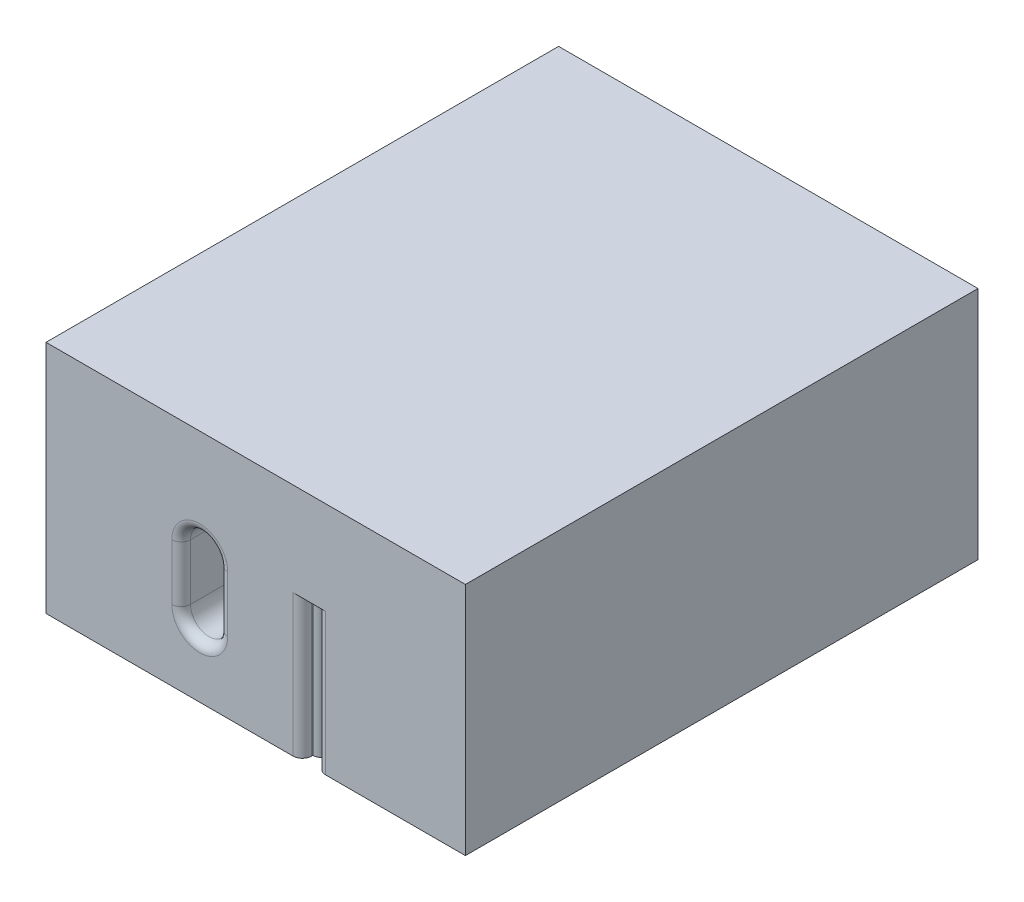
from build123d import *

# Parameters (mm, degrees)
ESQUISSE1_W             = 45
ESQUISSE1_H             = 25.2
BOSS_EXTRU_1_DEPTH      = 55
ENL_V_MAT_EXTRU_1_DEPTH = 15.2
ESQUISSE4_W             = 2
ESQUISSE4_H             = 11.757289378
ESQUISSE4_H_2           = 8.71932614
BOSS_EXTRU_2_DEPTH      = 15.2
BOSS_EXTRU_3_DEPTH      = 15.2
CONG_2_R                = 1
CONG_5_R                = 1
CONG_10_R               = 1


with BuildPart() as part:
    # Esquisse1 → Boss.-Extru.1 (new body)
    with BuildSketch(Plane.XY):
        with Locations((0, 2)):
            Rectangle(ESQUISSE1_W, ESQUISSE1_H)
        with BuildLine():
            Line((-4, 3), (-4, -3))
            ThreePointArc((-4, -3), (-6, -5), (-8, -3))
            Line((-8, -3), (-8, 3))
            ThreePointArc((-8, 3), (-6, 5), (-4, 3))
        make_face(mode=Mode.SUBTRACT)
    extrude(amount=BOSS_EXTRU_1_DEPTH)

    # Esquisse3 → Enlèv. mat.-Extru.1 (cut)
    with BuildSketch(Plane.XZ.offset(10.6)):
        with BuildLine():
            Line((5, 55), (5, 39.485421243))
            ThreePointArc((5, 39.485421243), (4.865561607, 38.024962206), (4.46676485, 36.613588609))
            Line((4.46676485, 36.613588609), (0.53323515, 26.386411391))
            ThreePointArc((0.53323515, 26.386411391), (0.134438393, 24.975037794), (0, 23.514578757))
            Line((0, 23.514578757), (0, 0))
            Line((0, 0), (2, 0))
            Line((2, 0), (2, 17.43865228))
            ThreePointArc((2, 17.43865228), (2.100303516, 18.986949278), (2.399537266, 20.509363004))
            Line((2.399537266, 20.509363004), (6.100462734, 34.490636996))
            ThreePointArc((6.100462734, 34.490636996), (6.399696484, 36.013050722), (6.5, 37.56134772))
            Line((6.5, 37.56134772), (6.5, 55))
            Line((6.5, 55), (5, 55))
        make_face()
        with BuildLine():
            Line((5, 17.43865228), (5, 0))
            Line((5, 0), (6.5, 0))
            Line((6.5, 0), (6.5, 15.514578757))
            ThreePointArc((6.5, 15.514578757), (6.634438393, 16.975037794), (7.03323515, 18.386411391))
            Line((7.03323515, 18.386411391), (10.96676485, 28.613588609))
            ThreePointArc((10.96676485, 28.613588609), (11.365561607, 30.024962206), (11.5, 31.485421243))
            Line((11.5, 31.485421243), (11.5, 55))
            Line((11.5, 55), (9.5, 55))
            Line((9.5, 55), (9.5, 37.56134772))
            ThreePointArc((9.5, 37.56134772), (9.399696484, 36.013050722), (9.100462734, 34.490636996))
            Line((9.100462734, 34.490636996), (5.399537266, 20.509363004))
            ThreePointArc((5.399537266, 20.509363004), (5.100303516, 18.986949278), (5, 17.43865228))
        make_face()
    extrude(amount=-ENL_V_MAT_EXTRU_1_DEPTH, mode=Mode.SUBTRACT)

    # Esquisse4 → Boss.-Extru.2 (add)
    with BuildSketch(Plane.XZ.offset(10.6)):
        with Locations((10.5, 49.121355311)):
            Rectangle(ESQUISSE4_W, ESQUISSE4_H)
        with Locations((1, 4.35966307)):
            Rectangle(ESQUISSE4_W, ESQUISSE4_H_2)
    extrude(amount=-BOSS_EXTRU_2_DEPTH)

    # Esquisse5 → Boss.-Extru.3 (add)
    with BuildSketch(Plane.XZ.offset(10.6)):
        with BuildLine():
            Line((5, 53.85), (5, 53.15))
            ThreePointArc((5, 53.15), (5.40348257, 53.21803486), (5.7, 53.5))
            ThreePointArc((5.7, 53.5), (5.40348257, 53.78196514), (5, 53.85))
        make_face()
        with BuildLine():
            Line((5, 51.85), (5, 51.15))
            ThreePointArc((5, 51.15), (5.40348257, 51.21803486), (5.7, 51.5))
            ThreePointArc((5.7, 51.5), (5.40348257, 51.78196514), (5, 51.85))
        make_face()
        with BuildLine():
            Line((5, 49.85), (5, 49.15))
            ThreePointArc((5, 49.15), (5.40348257, 49.21803486), (5.7, 49.5))
            ThreePointArc((5.7, 49.5), (5.40348257, 49.78196514), (5, 49.85))
        make_face()
        with BuildLine():
            Line((5, 47.85), (5, 47.15))
            ThreePointArc((5, 47.15), (5.40348257, 47.21803486), (5.7, 47.5))
            ThreePointArc((5.7, 47.5), (5.40348257, 47.78196514), (5, 47.85))
        make_face()
        with BuildLine():
            Line((5, 45.85), (5, 45.15))
            ThreePointArc((5, 45.15), (5.40348257, 45.21803486), (5.7, 45.5))
            ThreePointArc((5.7, 45.5), (5.40348257, 45.78196514), (5, 45.85))
        make_face()
        with BuildLine():
            Line((5, 43.85), (5, 43.15))
            ThreePointArc((5, 43.15), (5.40348257, 43.21803486), (5.7, 43.5))
            ThreePointArc((5.7, 43.5), (5.40348257, 43.78196514), (5, 43.85))
        make_face()
        with BuildLine():
            Line((5, 41.85), (5, 41.15))
            ThreePointArc((5, 41.15), (5.40348257, 41.21803486), (5.7, 41.5))
            ThreePointArc((5.7, 41.5), (5.40348257, 41.78196514), (5, 41.85))
        make_face()
        with BuildLine():
            Line((5, 39.85), (5, 39.15))
            ThreePointArc((5, 39.15), (5.40348257, 39.21803486), (5.7, 39.5))
            ThreePointArc((5.7, 39.5), (5.40348257, 39.78196514), (5, 39.85))
        make_face()
        with BuildLine():
            Line((5, 1.15), (5, 1.85))
            ThreePointArc((5, 1.85), (5.40348257, 1.78196514), (5.7, 1.5))
            ThreePointArc((5.7, 1.5), (5.40348257, 1.21803486), (5, 1.15))
        make_face()
        with BuildLine():
            Line((5, 15.15), (5, 15.85))
            ThreePointArc((5, 15.85), (5.40348257, 15.78196514), (5.7, 15.5))
            ThreePointArc((5.7, 15.5), (5.40348257, 15.21803486), (5, 15.15))
        make_face()
        with BuildLine():
            Line((5, 13.15), (5, 13.85))
            ThreePointArc((5, 13.85), (5.40348257, 13.78196514), (5.7, 13.5))
            ThreePointArc((5.7, 13.5), (5.40348257, 13.21803486), (5, 13.15))
        make_face()
        with BuildLine():
            Line((5, 11.15), (5, 11.85))
            ThreePointArc((5, 11.85), (5.40348257, 11.78196514), (5.7, 11.5))
            ThreePointArc((5.7, 11.5), (5.40348257, 11.21803486), (5, 11.15))
        make_face()
        with BuildLine():
            Line((5, 9.15), (5, 9.85))
            ThreePointArc((5, 9.85), (5.40348257, 9.78196514), (5.7, 9.5))
            ThreePointArc((5.7, 9.5), (5.40348257, 9.21803486), (5, 9.15))
        make_face()
        with BuildLine():
            Line((5, 7.15), (5, 7.85))
            ThreePointArc((5, 7.85), (5.40348257, 7.78196514), (5.7, 7.5))
            ThreePointArc((5.7, 7.5), (5.40348257, 7.21803486), (5, 7.15))
        make_face()
        with BuildLine():
            Line((5, 5.15), (5, 5.85))
            ThreePointArc((5, 5.85), (5.40348257, 5.78196514), (5.7, 5.5))
            ThreePointArc((5.7, 5.5), (5.40348257, 5.21803486), (5, 5.15))
        make_face()
        with BuildLine():
            Line((5, 3.15), (5, 3.85))
            ThreePointArc((5, 3.85), (5.40348257, 3.78196514), (5.7, 3.5))
            ThreePointArc((5.7, 3.5), (5.40348257, 3.21803486), (5, 3.15))
        make_face()
    extrude(amount=-BOSS_EXTRU_3_DEPTH)

    # Congé2
    cong_2_edges = [part.edges().sort_by_distance(p)[0] for p in [
        (2, -3, 8.71932614),
        (0, -3, 8.71932614),
        (11.5, -3, 43.242710622),
        (9.5, -3, 43.242710622),
    ]]
    fillet(cong_2_edges, radius=CONG_2_R - 0.0001)  # a hair under: the kernel refuses the full size

    # Congé5
    cong_5_edges = [part.edges().sort_by_distance(p)[0] for p in [
        (5, -3, 55),
        (6.5, -3, 55),
        (6.5, -3, 0),
        (5, -3, 0),
    ]]
    fillet(cong_5_edges, radius=CONG_5_R)

    # Congé10
    cong_10_edges = [part.edges().sort_by_distance(p)[0] for p in [
        (-6, 5, 0),
        (-8, 0, 0),
        (-6, -5, 0),
        (-4, 0, 0),
        (-6, 5, 55),
        (-8, 0, 55),
        (-6, -5, 55),
        (-4, 0, 55),
    ]]
    fillet(cong_10_edges, radius=CONG_10_R)


solid = part.part
